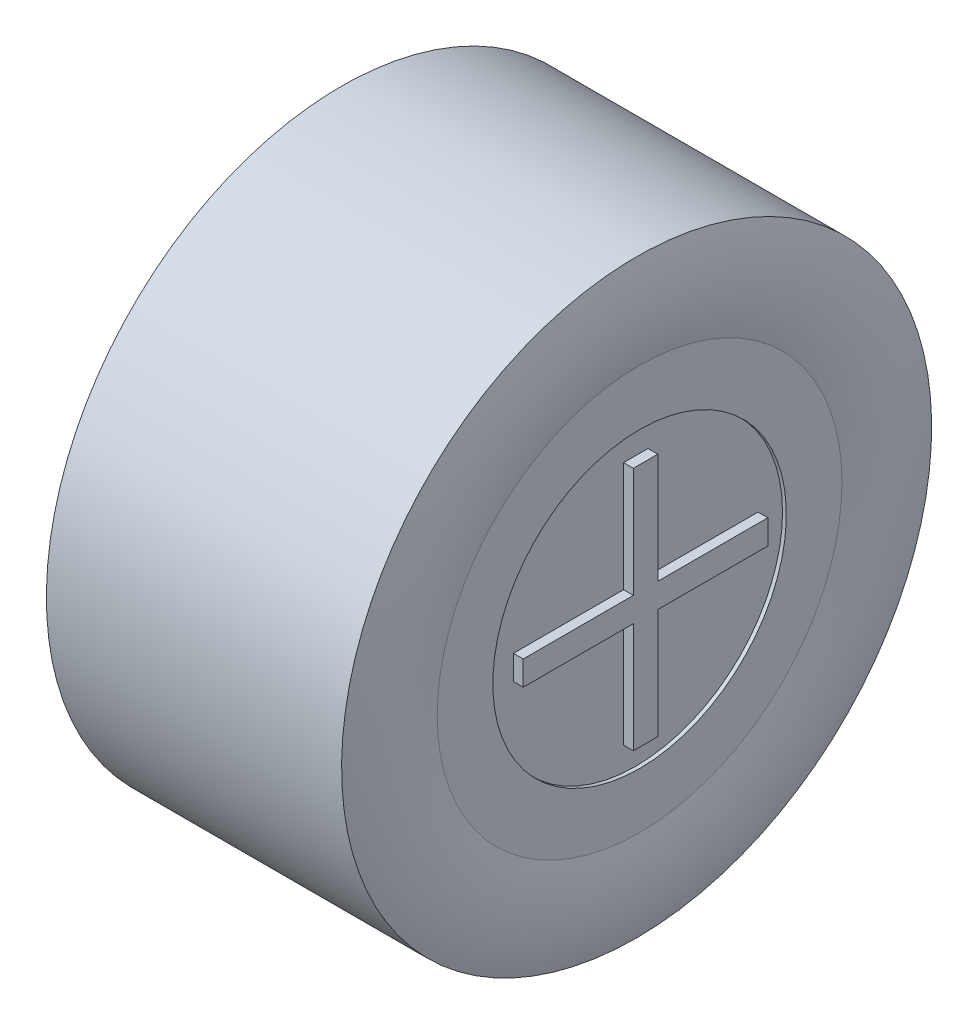
from build123d import *

# Parameters (mm, degrees)
REVOLVE_1_OUTLINE_W   = 0.355269541
REVOLVE_1_OUTLINE_H   = 0.438478825
REVOLVE_1_OUTLINE_W_2 = 11.364624133
REVOLVE_1_OUTLINE_W_3 = 4.372569082
REVOLVE_1_OUTLINE_H_2 = 55.75634902
REVOLVE_1_OUTLINE_H_3 = 1.854936884
REVOLVE_1_OUTLINE_W_4 = 14.211965544
REVOLVE_1_OUTLINE_H_4 = 0.61022171
SKETCH_2_R            = 30
EXTRUDE_1_DEPTH       = 30
SKETCH_3_R            = 7.5
EXTRUDE_2_DEPTH       = 37.14
SKETCH_4_W            = 5
SKETCH_4_H            = 22.5
SKETCH_4_W_2          = 22.5
SKETCH_4_H_2          = 5
EXTRUDE_3_DEPTH       = 2


# Read off the part's stored shape, not the designer's step: 회전1
with BuildPart() as part:
    # 회전1 outline → 회전1 (revolve)
    with BuildSketch(Plane.YX):
        with Locations((41.542258903, -28.097413923)):
            Rectangle(REVOLVE_1_OUTLINE_W, REVOLVE_1_OUTLINE_H)
        with BuildLine():
            add(Edge.make_bspline(
                [(41.719893674, -27.87817451), (41.894749248, -27.921618592), (42.252720208, -28.01137838), (42.873298399, -28.15700866), (43.341279515, -28.256769587), (43.642191366, -28.316653335)],
                knots=[0.117139278, 0.117139278, 0.117139278, 0.117139278, 0.14529069, 0.173442101, 0.224513922, 0.224513922, 0.224513922, 0.224513922], degree=3))
            Line((41.719893674, -27.87817451), (41.719893674, -28.316653335))
            Line((41.719893674, -28.316653335), (43.642191366, -28.316653335))
        make_face()
        with BuildLine():
            add(Edge.make_bspline(
                [(43.642191366, -28.316653335), (43.673012094, -28.322786894), (44.367114713, -28.459908676), (46.367881136, -28.788520691), (49.637320271, -29.015805628), (53.021708434, -28.821695589), (55.131271584, -28.478533008), (55.931859218, -28.316653335)],
                knots=[0.224513922, 0.224513922, 0.224513922, 0.224513922, 0.229744924, 0.34235057, 0.567561862, 0.792773154, 0.932194296, 0.932194296, 0.932194296, 0.932194296], degree=3))
            Line((43.642191366, -28.316653335), (41.719893674, -28.316653335))
            Line((41.719893674, -28.316653335), (41.719893674, -30.171590219))
            Line((41.719893674, -30.171590219), (55.931859218, -30.171590219))
            Line((55.931859218, -30.171590219), (55.931859218, -28.316653335))
        make_face()
        with Locations((35.682312067, -28.097413923)):
            Rectangle(REVOLVE_1_OUTLINE_W_2, REVOLVE_1_OUTLINE_H)
        with Locations((58.118143759, -28.097413923)):
            Rectangle(REVOLVE_1_OUTLINE_W_3, REVOLVE_1_OUTLINE_H)
        with Locations((58.118143759, 0)):
            Rectangle(REVOLVE_1_OUTLINE_W_3, REVOLVE_1_OUTLINE_H_2)
        with BuildLine():
            Line((41.719893674, 28.316653335), (41.719893674, 27.87817451))
            add(Edge.make_bspline(
                [(43.128876316, 28.316653335), (42.973861456, 28.272694047), (42.669494175, 28.183372992), (42.227403007, 28.044794313), (41.884836208, 27.931979132), (41.719893674, 27.87817451)],
                knots=[0.937972384, 0.937972384, 0.937972384, 0.937972384, 0.966974102, 0.995182728, 1.023391355, 1.023391355, 1.023391355, 1.023391355], degree=3))
            Line((43.128876316, 28.316653335), (41.719893674, 28.316653335))
        make_face()
        with Locations((41.542258903, 28.097413923)):
            Rectangle(REVOLVE_1_OUTLINE_W, REVOLVE_1_OUTLINE_H)
        with Locations((41.542258903, -29.244121777)):
            Rectangle(REVOLVE_1_OUTLINE_W, REVOLVE_1_OUTLINE_H_3)
        with Locations((58.118143759, -29.244121777)):
            Rectangle(REVOLVE_1_OUTLINE_W_3, REVOLVE_1_OUTLINE_H_3)
        with Locations((35.682312067, -29.244121777)):
            Rectangle(REVOLVE_1_OUTLINE_W_2, REVOLVE_1_OUTLINE_H_3)
        with Locations((35.682312067, 28.097413923)):
            Rectangle(REVOLVE_1_OUTLINE_W_2, REVOLVE_1_OUTLINE_H)
        with Locations((58.118143759, 28.097413923)):
            Rectangle(REVOLVE_1_OUTLINE_W_3, REVOLVE_1_OUTLINE_H)
        with BuildLine():
            Line((41.719893674, 28.316653335), (43.128876316, 28.316653335))
            add(Edge.make_bspline(
                [(55.931859218, 28.316653335), (55.350466054, 28.484554725), (54.483083768, 28.700477141), (53.332821917, 28.919070087), (52.621816991, 29.026887301), (51.140275095, 29.207221888), (48.779721438, 29.304602769), (45.95584246, 28.998713875), (44.028351242, 28.564756145), (43.275412999, 28.358208372), (43.128876316, 28.316653335)],
                knots=[0.120715306, 0.120715306, 0.120715306, 0.120715306, 0.233549812, 0.285972839, 0.342390092, 0.370598718, 0.57205333, 0.797722342, 0.910556849, 0.937972384, 0.937972384, 0.937972384, 0.937972384], degree=3))
            Line((55.931859218, 28.316653335), (55.931859218, 30.171590219))
            Line((55.931859218, 30.171590219), (41.719893674, 30.171590219))
            Line((41.719893674, 30.171590219), (41.719893674, 28.316653335))
        make_face()
        with Locations((41.542258903, 29.244121777)):
            Rectangle(REVOLVE_1_OUTLINE_W, REVOLVE_1_OUTLINE_H_3)
        with Locations((48.825876446, -30.476701074)):
            Rectangle(REVOLVE_1_OUTLINE_W_4, REVOLVE_1_OUTLINE_H_4)
        with Locations((41.542258903, -30.476701074)):
            Rectangle(REVOLVE_1_OUTLINE_W, REVOLVE_1_OUTLINE_H_4)
        with BuildLine():
            Line((60.3044283, -30.171590219), (55.931859218, -30.171590219))
            Line((55.931859218, -30.171590219), (55.931859218, -30.781811929))
            Line((55.931859218, -30.781811929), (58.176696805, -30.781811929))
            add(Edge.make_bspline(
                [(60.3044283, -30.171590219), (59.242057092, -30.511353598), (58.176696805, -30.781811929)],
                knots=[0, 0, 0, 0.113573553, 0.113573553, 0.113573553], degree=2))
        make_face()
        with Locations((35.682312067, -30.476701074)):
            Rectangle(REVOLVE_1_OUTLINE_W_2, REVOLVE_1_OUTLINE_H_4)
        with Locations((35.682312067, 29.244121777)):
            Rectangle(REVOLVE_1_OUTLINE_W_2, REVOLVE_1_OUTLINE_H_3)
        with Locations((58.118143759, 29.244121777)):
            Rectangle(REVOLVE_1_OUTLINE_W_3, REVOLVE_1_OUTLINE_H_3)
        with Locations((41.542258903, 30.476701074)):
            Rectangle(REVOLVE_1_OUTLINE_W, REVOLVE_1_OUTLINE_H_4)
        with Locations((48.825876446, 30.476701074)):
            Rectangle(REVOLVE_1_OUTLINE_W_4, REVOLVE_1_OUTLINE_H_4)
        with BuildLine():
            Line((55.931859218, -30.781811929), (41.719893674, -30.781811929))
            Line((41.719893674, -30.781811929), (41.719893674, -30.868243844))
            add(Edge.make_bspline(
                [(49.816181075, -31.837257545), (45.788933817, -31.837257541), (41.719893674, -30.868243844)],
                knots=[0.556786778, 0.556786778, 0.556786778, 0.981464752, 0.981464752, 0.981464752], degree=2))
            add(Edge.make_bspline(
                [(55.931859218, -31.274158213), (52.886163188, -31.837257547), (49.816181075, -31.837257545)],
                knots=[0.233053543, 0.233053543, 0.233053543, 0.556786778, 0.556786778, 0.556786778], degree=2))
            Line((55.931859218, -31.274158213), (55.931859218, -30.781811929))
        make_face()
        with BuildLine():
            Line((41.719893674, -30.868243844), (41.719893674, -30.781811929))
            Line((41.719893674, -30.781811929), (41.364624133, -30.781811929))
            add(Edge.make_bspline(
                [(41.719893674, -30.868243844), (41.54229871, -30.825950834), (41.364624133, -30.781811929)],
                knots=[0.981464752, 0.981464752, 0.981464752, 1, 1, 1], degree=2))
        make_face()
        with BuildLine():
            Line((58.176696805, -30.781811929), (55.931859218, -30.781811929))
            Line((55.931859218, -30.781811929), (55.931859218, -31.274158213))
            add(Edge.make_bspline(
                [(58.176696805, -30.781811929), (57.055932041, -31.066335551), (55.931859218, -31.274158213)],
                knots=[0.113573553, 0.113573553, 0.113573553, 0.233053543, 0.233053543, 0.233053543], degree=2))
        make_face()
        with Locations((35.682312067, 30.476701074)):
            Rectangle(REVOLVE_1_OUTLINE_W_2, REVOLVE_1_OUTLINE_H_4)
        with BuildLine():
            Line((55.931859218, 30.781811929), (55.931859218, 30.171590219))
            Line((55.931859218, 30.171590219), (60.3044283, 30.171590219))
            add(Edge.make_bspline(
                [(58.176696805, 30.781811929), (59.242057092, 30.511353598), (60.3044283, 30.171590219)],
                knots=[0.886426447, 0.886426447, 0.886426447, 1, 1, 1], degree=2))
            Line((58.176696805, 30.781811929), (55.931859218, 30.781811929))
        make_face()
        with BuildLine():
            Line((41.364624133, 30.781811929), (41.719893674, 30.781811929))
            Line((41.719893674, 30.781811929), (41.719893674, 30.868243844))
            add(Edge.make_bspline(
                [(41.364624133, 30.781811929), (41.54229871, 30.825950834), (41.719893674, 30.868243844)],
                knots=[0, 0, 0, 0.018535248, 0.018535248, 0.018535248], degree=2))
        make_face()
        with BuildLine():
            Line((41.719893674, 30.868243844), (41.719893674, 30.781811929))
            Line((41.719893674, 30.781811929), (55.931859218, 30.781811929))
            Line((55.931859218, 30.781811929), (55.931859218, 31.274158213))
            add(Edge.make_bspline(
                [(49.816181262, 31.837257545), (52.886163281, 31.83725753), (55.931859218, 31.274158213)],
                knots=[0.443213232, 0.443213232, 0.443213232, 0.766946457, 0.766946457, 0.766946457], degree=2))
            add(Edge.make_bspline(
                [(41.719893674, 30.868243844), (45.788933912, 31.837257564), (49.816181262, 31.837257545)],
                knots=[0.018535248, 0.018535248, 0.018535248, 0.443213232, 0.443213232, 0.443213232], degree=2))
        make_face()
        with BuildLine():
            Line((55.931859218, 31.274158213), (55.931859218, 30.781811929))
            Line((55.931859218, 30.781811929), (58.176696805, 30.781811929))
            add(Edge.make_bspline(
                [(55.931859218, 31.274158213), (57.055932041, 31.066335551), (58.176696805, 30.781811929)],
                knots=[0.766946457, 0.766946457, 0.766946457, 0.886426447, 0.886426447, 0.886426447], degree=2))
        make_face()
    revolve(axis=Axis((0, 0, 0), (1, 0, 0)))

    # 스케치2 → 보스-돌출1 (add, symmetric)
    with BuildSketch(Plane(origin=(0, 0, 0), x_dir=(0, 0, -1), z_dir=(1, 0, 0))):
        with Locations(Location((0, 0, 0), (0, 0, 270))):
            Circle(SKETCH_2_R)
    extrude(amount=EXTRUDE_1_DEPTH, both=True)

    # 스케치3 → 보스-돌출2 (add)
    with BuildSketch(Plane.ZY.offset(30)):
        with Locations(Location((0, 0, 0), (0, 0, 180))):
            Circle(SKETCH_3_R)
    extrude(amount=EXTRUDE_2_DEPTH)

    # 스케치4 → 보스-돌출3 (add)
    with BuildSketch(Plane(origin=(30, 0, 0), x_dir=(0, 0, -1), z_dir=(1, 0, 0))):
        with Locations((0, 13.75)):
            Rectangle(SKETCH_4_W, SKETCH_4_H)
        with Locations((-13.75, 0)):
            Rectangle(SKETCH_4_W_2, SKETCH_4_H_2)
        Rectangle(SKETCH_4_W, SKETCH_4_H_2)
        with Locations((13.75, 0)):
            Rectangle(SKETCH_4_W_2, SKETCH_4_H_2)
        with Locations((0, -13.75)):
            Rectangle(SKETCH_4_W, SKETCH_4_H)
    extrude(amount=EXTRUDE_3_DEPTH)


solid = part.part
